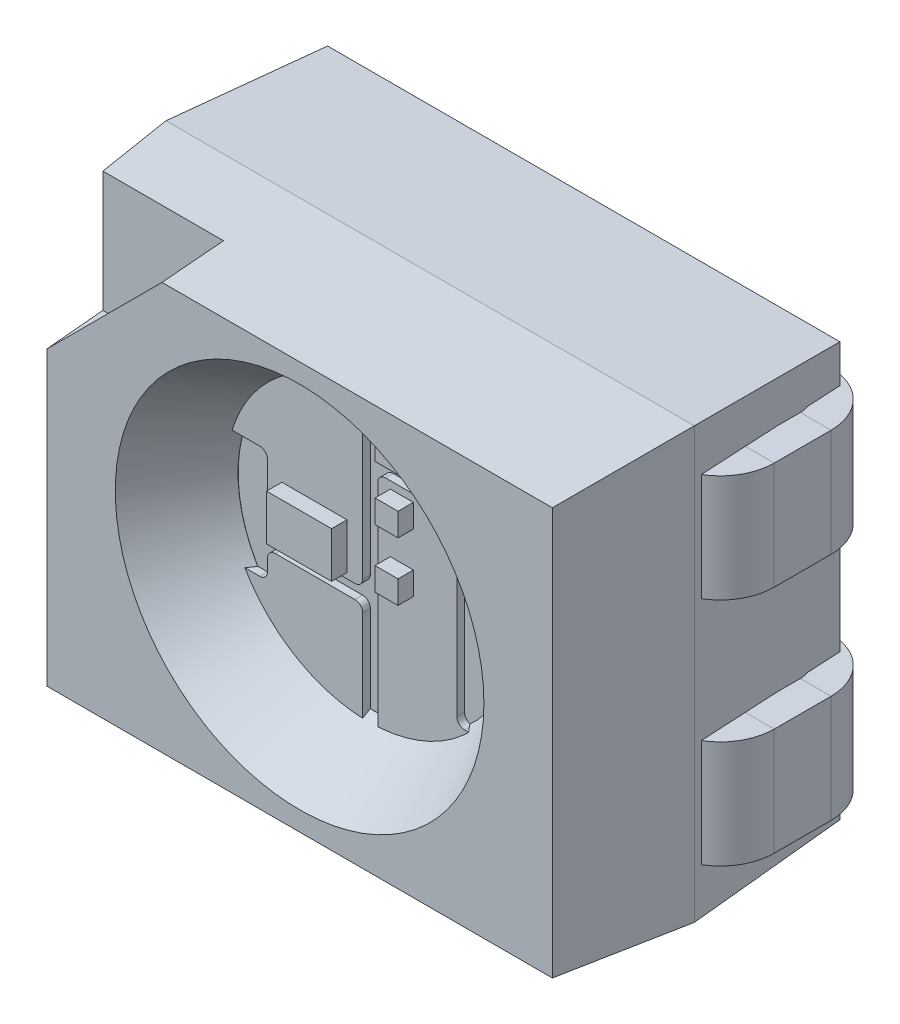
from build123d import *

# Parameters (mm, degrees)
SKETCH_1_W                       = 3.44
SKETCH_1_H                       = 2.8
EXTRUDE_1_DEPTH                  = 1
EXTRUDE_1_DRAFT                  = -3
SKETCH_3_R                       = 0.55
SKETCH_3_W                       = 0.667592221
SKETCH_3_H                       = 0.7
CUT_EXTRUDE_1_DEPTH              = 0.13
SKETCH_5_W                       = 0.69
SKETCH_5_H                       = 0.7
SM_BASE_FLANGE_1_DEPTH           = 0.2
SM_EDGE_FLANGE_1_STRIP_W         = 1.1
SM_EDGE_FLANGE_1_STRIP_H         = 0.2
SM_EDGE_FLANGE_1_STRIP_CUT_DEPTH = 0.7
SM_EDGE_FLANGE_1_DEPTH           = 0.7
SM_EDGE_FLANGE_2_STRIP_W         = 1.1
SM_EDGE_FLANGE_2_STRIP_H         = 0.2
SM_EDGE_FLANGE_2_STRIP_CUT_DEPTH = 0.7
SM_EDGE_FLANGE_2_DEPTH           = 0.7
PATTERN_LINEAR_1_COUNT           = 2
PATTERN_LINEAR_1_PITCH           = 1.5
SKETCH_30_W                      = 3.44
SKETCH_30_H                      = 2.8
EXTRUDE_3_DEPTH                  = 0.85
EXTRUDE_3_TAPER                  = 5
CUT_EXTRUDE_2_DEPTH              = 0.4
SKETCH_34_R                      = 0.9
CUT_EXTRUDE_3_DEPTH              = 0.5
CHAMFER_1_SIZE                   = 0.3
CHAMFER_1_SIZE2                  = 0.499283845
EXTRUDE_4_DEPTH                  = 0.05
EXTRUDE_4_2_DEPTH                = 0.05
EXTRUDE_4_3_DEPTH                = 0.05
EXTRUDE_4_4_DEPTH                = 0.05
SKETCH_49_W                      = 0.423711769
SKETCH_49_H                      = 0.297484251
EXTRUDE_5_DEPTH                  = 0.1
SKETCH_49_W_2                    = 0.15
SKETCH_49_H_2                    = 0.15
EXTRUDE_5_2_DEPTH                = 0.1
EXTRUDE_5_3_DEPTH                = 0.1
EXTRUDE_5_4_DEPTH                = 0.1


# Sheet-metal steps are written as plain solids
with BuildPart() as part:
    # Sketch 1 → Бобышка-Вытянуть1 (with draft: the straight prism first)
    with BuildSketch(Plane.XY):
        Rectangle(SKETCH_1_W, SKETCH_1_H)
    extrude(amount=-EXTRUDE_1_DEPTH)
    # Бобышка-Вытянуть1: the draft: its side faces are tilted about the plane it starts from
    extrude_1_sides = [part.faces().sort_by_distance(p)[0] for p in [
        (-1.72, 0, -0.5),
        (0, -1.4, -0.5),
        (1.72, 0, -0.5),
        (0, 1.4, -0.5),
    ]]
    draft(extrude_1_sides, Plane.XY, EXTRUDE_1_DRAFT)

    # Sketch 3 → Вырез-Вытянуть1 (cut)
    with BuildSketch(Plane(origin=(0, 0, -1), x_dir=(-1, 0, 0), z_dir=(0, 0, -1))):
        Circle(SKETCH_3_R)
        with Locations((-1.333796111, 0.75)):
            Rectangle(SKETCH_3_W, SKETCH_3_H)
        with Locations((1.333796111, 0.75)):
            Rectangle(SKETCH_3_W, SKETCH_3_H)
        with Locations((-1.333796111, -0.75)):
            Rectangle(SKETCH_3_W, SKETCH_3_H)
        with Locations((1.333796111, -0.75)):
            Rectangle(SKETCH_3_W, SKETCH_3_H)
    extrude(amount=-CUT_EXTRUDE_1_DEPTH, mode=Mode.SUBTRACT)



with BuildPart() as body_2:
    # Sketch 5 → Базовая кромка1 (new body)
    with BuildSketch(Plane(origin=(0, 0, -0.87), x_dir=(-1, 0, 0), z_dir=(0, 0, -1))):
        with Locations((-1.345, 0.75)):
            Rectangle(SKETCH_5_W, SKETCH_5_H)
    extrude(amount=SM_BASE_FLANGE_1_DEPTH)

    # Ребро-кромка1 strip (across the edge) → Ребро-кромка1 strip cut (cut)
    with BuildSketch(Plane(origin=(1.69, 0.4, -0.87), x_dir=(-1, 0, 0), z_dir=(0, 1, 0))):
        with Locations((-0.4, -0.1)):
            Rectangle(SM_EDGE_FLANGE_1_STRIP_W, SM_EDGE_FLANGE_1_STRIP_H)
    extrude(amount=SM_EDGE_FLANGE_1_STRIP_CUT_DEPTH, mode=Mode.SUBTRACT)

    # Ребро-кромка1 section (across the edge) → Ребро-кромка1 (add)
    with BuildSketch(Plane(origin=(1.69, 0.4, -0.87), x_dir=(-1, 0, 0), z_dir=(0, 1, 0))):
        with BuildLine():
            Line((-0.2, 0.15), (-0.2, 0.87))
            Line((-0.2, 0.87), (0, 0.87))
            Line((0, 0.87), (0, 0.15))
            ThreePointArc((0, 0.15), (0.043933983, 0.043933983), (0.15, 0))
            Line((0.15, 0), (0.15, -0.2))
            ThreePointArc((0.15, -0.2), (-0.097487373, -0.097487373), (-0.2, 0.15))
        make_face()
    extrude(amount=SM_EDGE_FLANGE_1_DEPTH)

    # Ребро-кромка2 strip (across the edge) → Ребро-кромка2 strip cut (cut)
    with BuildSketch(Plane(origin=(1.69, 0.4, 0), x_dir=(0, 0, -1), z_dir=(0, 1, 0))):
        with Locations((-0.2, -0.1)):
            Rectangle(SM_EDGE_FLANGE_2_STRIP_W, SM_EDGE_FLANGE_2_STRIP_H)
    extrude(amount=SM_EDGE_FLANGE_2_STRIP_CUT_DEPTH, mode=Mode.SUBTRACT)

    # Ребро-кромка2 section (across the edge) → Ребро-кромка2 (add)
    with BuildSketch(Plane(origin=(1.69, 0.4, 0), x_dir=(0, 0, -1), z_dir=(0, 1, 0))):
        with BuildLine():
            Line((0, 0.15), (0, 0.4))
            Line((0, 0.4), (0.2, 0.4))
            Line((0.2, 0.4), (0.2, 0.15))
            ThreePointArc((0.2, 0.15), (0.243933983, 0.043933983), (0.35, 0))
            Line((0.35, 0), (0.35, -0.2))
            ThreePointArc((0.35, -0.2), (0.102512627, -0.097487373), (0, 0.15))
        make_face()
    extrude(amount=SM_EDGE_FLANGE_2_DEPTH)


with BuildPart() as pattern_linear_1_1:
    # Линейный массив1: pattern copy
    add(body_2.part.moved(Location(Vector(0, -1, 0) * (1 * PATTERN_LINEAR_1_PITCH))))


with BuildPart() as body_4:
    # Зеркальное отражение1: mirrored copy
    add(body_2.part.mirror(Plane(origin=(0, 0, 0), x_dir=(0, 0, 1), z_dir=(1, 0, 0))))


with BuildPart() as body_5:
    # Mirror 1 2: mirrored copy
    add(pattern_linear_1_1.part.mirror(Plane(origin=(0, 0, 0), x_dir=(0, 0, 1), z_dir=(1, 0, 0))))


with BuildPart() as part_1:
    add(part.part)

    add(body_2.part)  # Бобышка-Вытянуть3 merges body 2

    add(pattern_linear_1_1.part)  # Бобышка-Вытянуть3 merges Линейный массив1_1

    add(body_4.part)  # Бобышка-Вытянуть3 merges body 4

    add(body_5.part)  # Бобышка-Вытянуть3 merges body 5
    # Эскиз30 → Бобышка-Вытянуть3 (add)
    with BuildSketch(Plane.XY):
        Rectangle(SKETCH_30_W, SKETCH_30_H)
    extrude(amount=EXTRUDE_3_DEPTH, taper=EXTRUDE_3_TAPER)

    # Эскиз33 → Вырез-Вытянуть2 (cut)
    with BuildSketch(Plane.XY.offset(0.85)):
        Polygon((-0.895634636, 1.325634636), (-1.645634636, 0.575634636), (-2.879687624, 0.575634636), (-2.879687624, 2.879687624), (-0.895634636, 2.879687624), align=None)
    extrude(amount=-CUT_EXTRUDE_2_DEPTH, mode=Mode.SUBTRACT)

    # Эскиз34 → Вырез-Вытянуть3 (cut)
    with BuildSketch(Plane.XY.offset(0.85)):
        Circle(SKETCH_34_R)
    extrude(amount=-CUT_EXTRUDE_3_DEPTH, mode=Mode.SUBTRACT)

    # Фаска1
    chamfer_1_edges = [part_1.edges().sort_by_distance(p)[0] for p in [
        (-0.9, 0, 0.85),
    ]]
    chamfer_1_side = [part_1.faces().sort_by_distance(p)[0] for p in [
        (0, -1.283371553, 0.85),
    ]]
    chamfer(chamfer_1_edges, length=CHAMFER_1_SIZE, length2=CHAMFER_1_SIZE2, reference=chamfer_1_side[0])


with BuildPart() as body_2_2:
    # Эскиз48 → Бобышка-Вытянуть4 (new body)
    with BuildSketch(Plane.XY.offset(0.35)):
        with BuildLine():
            Line((0.059009947, -0.958170677), (0.059009947, 0.45096966))
            ThreePointArc((0.059009947, 0.45096966), (0.073654608, 0.486324999), (0.109009947, 0.50096966))
            Line((0.109009947, 0.50096966), (0.523920369, 0.50096966))
            ThreePointArc((0.523920369, 0.50096966), (0.559275708, 0.486324999), (0.573920369, 0.45096966))
            Line((0.573920369, 0.45096966), (0.573920369, -0.612749155))
            ThreePointArc((0.573920369, -0.612749155), (0.58856503, -0.648104494), (0.623920369, -0.662749155))
            Line((0.623920369, -0.662749155), (0.761798951, -0.662749155))
            Line((0.761798951, -0.662749155), (0.761798951, -0.958170677))
            Line((0.761798951, -0.958170677), (0.059009947, -0.958170677))
        make_face()
    extrude(amount=EXTRUDE_4_DEPTH)


with BuildPart() as body_3:
    # Эскиз48 → Extrude 4 2 (new body)
    with BuildSketch(Plane.XY.offset(0.35)):
        with BuildLine():
            Line((0.059009947, 1.082676661), (0.702963992, 1.082676661))
            Line((0.702963992, 1.082676661), (0.702963992, 0.584256601))
            Line((0.702963992, 0.584256601), (0.109009947, 0.584256601))
            ThreePointArc((0.109009947, 0.584256601), (0.073654608, 0.598901262), (0.059009947, 0.634256601))
            Line((0.059009947, 0.634256601), (0.059009947, 1.082676661))
        make_face()
    extrude(amount=EXTRUDE_4_2_DEPTH)


with BuildPart() as body_4_2:
    # Эскиз48 → Extrude 4 3 (new body)
    with BuildSketch(Plane.XY.offset(0.35)):
        with BuildLine():
            Line((-0.039130176, -1.004290426), (-0.039130176, -0.334579702))
            ThreePointArc((-0.039130176, -0.334579702), (-0.053774837, -0.299224363), (-0.089130176, -0.284579702))
            Line((-0.089130176, -0.284579702), (-0.608977855, -0.284579702))
            ThreePointArc((-0.608977855, -0.284579702), (-0.644333194, -0.299224363), (-0.658977855, -0.334579702))
            Line((-0.658977855, -0.334579702), (-0.658977855, -0.413006558))
            ThreePointArc((-0.658977855, -0.413006558), (-0.673622516, -0.448361897), (-0.708977855, -0.463006558))
            Line((-0.708977855, -0.463006558), (-0.818312154, -0.463006558))
            Line((-0.818312154, -0.463006558), (-0.818312154, -1.004290426))
            Line((-0.818312154, -1.004290426), (-0.039130176, -1.004290426))
        make_face()
    extrude(amount=EXTRUDE_4_3_DEPTH)


with BuildPart() as body_5_2:
    # Эскиз48 → Extrude 4 4 (new body)
    with BuildSketch(Plane.XY.offset(0.35)):
        with BuildLine():
            Line((-0.039130176, 0.984110402), (-0.888741187, 0.984110402))
            Line((-0.888741187, 0.984110402), (-0.888741187, 0.271021616))
            Line((-0.888741187, 0.271021616), (-0.708977855, 0.271021616))
            ThreePointArc((-0.708977855, 0.271021616), (-0.673622516, 0.256376955), (-0.658977855, 0.221021616))
            Line((-0.658977855, 0.221021616), (-0.658977855, -0.143579013))
            ThreePointArc((-0.658977855, -0.143579013), (-0.644333194, -0.178934352), (-0.608977855, -0.193579013))
            Line((-0.608977855, -0.193579013), (-0.089130176, -0.193579013))
            ThreePointArc((-0.089130176, -0.193579013), (-0.053774837, -0.178934352), (-0.039130176, -0.143579013))
            Line((-0.039130176, -0.143579013), (-0.039130176, 0.984110402))
        make_face()
    extrude(amount=EXTRUDE_4_4_DEPTH)


with BuildPart() as body_6:
    # Эскиз49 → Бобышка-Вытянуть5 (new body)
    with BuildSketch(Plane.XY.offset(0.4)):
        with Locations((-0.353441563, -0.009663473)):
            Rectangle(SKETCH_49_W, SKETCH_49_H)
    extrude(amount=EXTRUDE_5_DEPTH)


with BuildPart() as body_7:
    # Эскиз49 → Extrude 5 2 (new body)
    with BuildSketch(Plane.XY.offset(0.4)):
        with Locations((0.215810569, 0.734743971)):
            Rectangle(SKETCH_49_W_2, SKETCH_49_H_2)
    extrude(amount=EXTRUDE_5_2_DEPTH)


with BuildPart() as body_8:
    # Эскиз49 → Extrude 5 3 (new body)
    with BuildSketch(Plane.XY.offset(0.4)):
        with Locations((0.215810569, 0.378392896)):
            Rectangle(SKETCH_49_W_2, SKETCH_49_H_2)
    extrude(amount=EXTRUDE_5_3_DEPTH)


with BuildPart() as body_9:
    # Эскиз49 → Extrude 5 4 (new body)
    with BuildSketch(Plane.XY.offset(0.4)):
        with Locations((0.215810569, -0.002583161)):
            Rectangle(SKETCH_49_W_2, SKETCH_49_H_2)
    extrude(amount=EXTRUDE_5_4_DEPTH)


solid = Compound([part_1.part, body_2_2.part, body_3.part, body_4_2.part, body_5_2.part, body_6.part, body_7.part, body_8.part, body_9.part])
